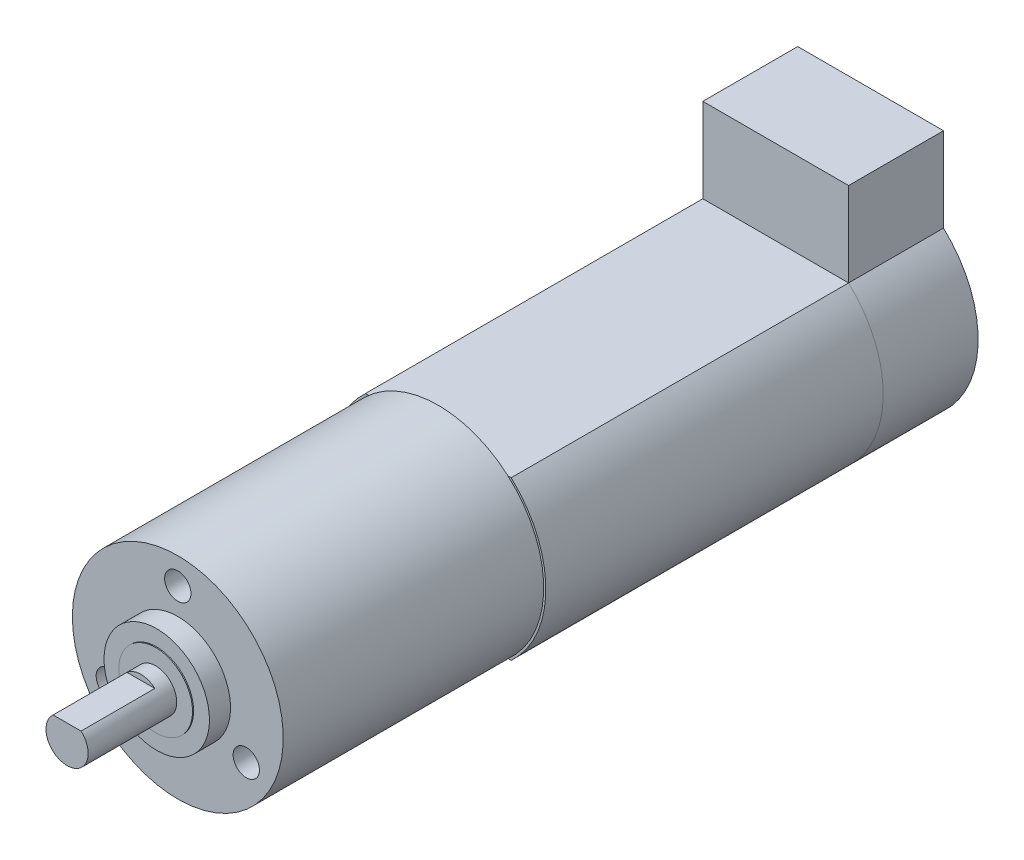
from build123d import *

# Parameters (mm, degrees)
BOSS_EXTRUDE1_DEPTH = 7
SKETCH2_R           = 2
BOSS_EXTRUDE2_DEPTH = 1.4
SKETCH3_R           = 3.5
BOSS_EXTRUDE3_DEPTH = 0.1
SKETCH4_R           = 5
BOSS_EXTRUDE4_DEPTH = 2
SKETCH5_R           = 10
BOSS_EXTRUDE5_DEPTH = 24.7
SKETCH6_R           = 1.25
SCREW_HOLES_DEPTH   = 5
MOTOR_DEPTH         = 32
ENCODER_DEPTH       = 9


with BuildPart() as part:
    # Sketch1 → Boss-Extrude1 (new body)
    with BuildSketch(Plane.XY):
        with BuildLine():
            Line((-1.322875656, 1.5), (1.322875656, 1.5))
            ThreePointArc((1.322875656, 1.5), (0, -2), (-1.322875656, 1.5))
        make_face()
    extrude(amount=-BOSS_EXTRUDE1_DEPTH)

    # Sketch2 → Boss-Extrude2 (add)
    with BuildSketch(Plane(origin=(0, 0, -7), x_dir=(-1, 0, 0), z_dir=(0, 0, -1))):
        Circle(SKETCH2_R)
    extrude(amount=BOSS_EXTRUDE2_DEPTH)

    # Sketch3 → Boss-Extrude3 (add)
    with BuildSketch(Plane(origin=(0, 0, -8.4), x_dir=(-1, 0, 0), z_dir=(0, 0, -1))):
        Circle(SKETCH3_R)
    extrude(amount=BOSS_EXTRUDE3_DEPTH)


with BuildPart() as body_2:
    # Sketch4 → Boss-Extrude4 (new body)
    with BuildSketch(Plane(origin=(0, 0, -8.5), x_dir=(-1, 0, 0), z_dir=(0, 0, -1))):
        Circle(SKETCH4_R)
    extrude(amount=BOSS_EXTRUDE4_DEPTH)

    # Sketch5 → Boss-Extrude5 (add)
    with BuildSketch(Plane(origin=(0, 0, -10.5), x_dir=(-1, 0, 0), z_dir=(0, 0, -1))):
        Circle(SKETCH5_R)
    extrude(amount=BOSS_EXTRUDE5_DEPTH)

    # Sketch6 → Screw Holes (cut)
    with BuildSketch(Plane.XY.offset(-10.5)):
        with Locations((0, 7.5)):
            Circle(SKETCH6_R)
        with Locations((6.495190528, -3.75)):
            Circle(SKETCH6_R)
        with Locations((-6.495190528, -3.75)):
            Circle(SKETCH6_R)
    extrude(amount=-SCREW_HOLES_DEPTH, mode=Mode.SUBTRACT)


with BuildPart() as body_3:
    # Sketch10 → Motor (new body)
    with BuildSketch(Plane(origin=(0, 0, -35.2), x_dir=(-1, 0, 0), z_dir=(0, 0, -1))):
        with BuildLine():
            Line((-6.913031173, 7.5), (6.913031173, 7.5))
            ThreePointArc((6.913031173, 7.5), (10.2, 0), (6.913031173, -7.5))
            Line((6.913031173, -7.5), (-6.913031173, -7.5))
            ThreePointArc((-6.913031173, -7.5), (-10.2, 0), (-6.913031173, 7.5))
        make_face()
    extrude(amount=MOTOR_DEPTH)


with BuildPart() as body_4:
    # Sketch11 → Encoder (new body)
    with BuildSketch(Plane(origin=(0, 0, -67.2), x_dir=(-1, 0, 0), z_dir=(0, 0, -1))):
        with BuildLine():
            Line((-6.913031173, -7.5), (6.913031173, -7.5))
            ThreePointArc((6.913031173, -7.5), (10.2, 0), (6.913031173, 7.5))
            Line((6.913031173, 7.5), (6.913031173, 15.5))
            Line((6.913031173, 15.5), (-6.913031173, 15.5))
            Line((-6.913031173, 15.5), (-6.913031173, 7.5))
            ThreePointArc((-6.913031173, 7.5), (-10.2, 0), (-6.913031173, -7.5))
        make_face()
    extrude(amount=ENCODER_DEPTH)


solid = Compound([part.part, body_2.part, body_3.part, body_4.part])
